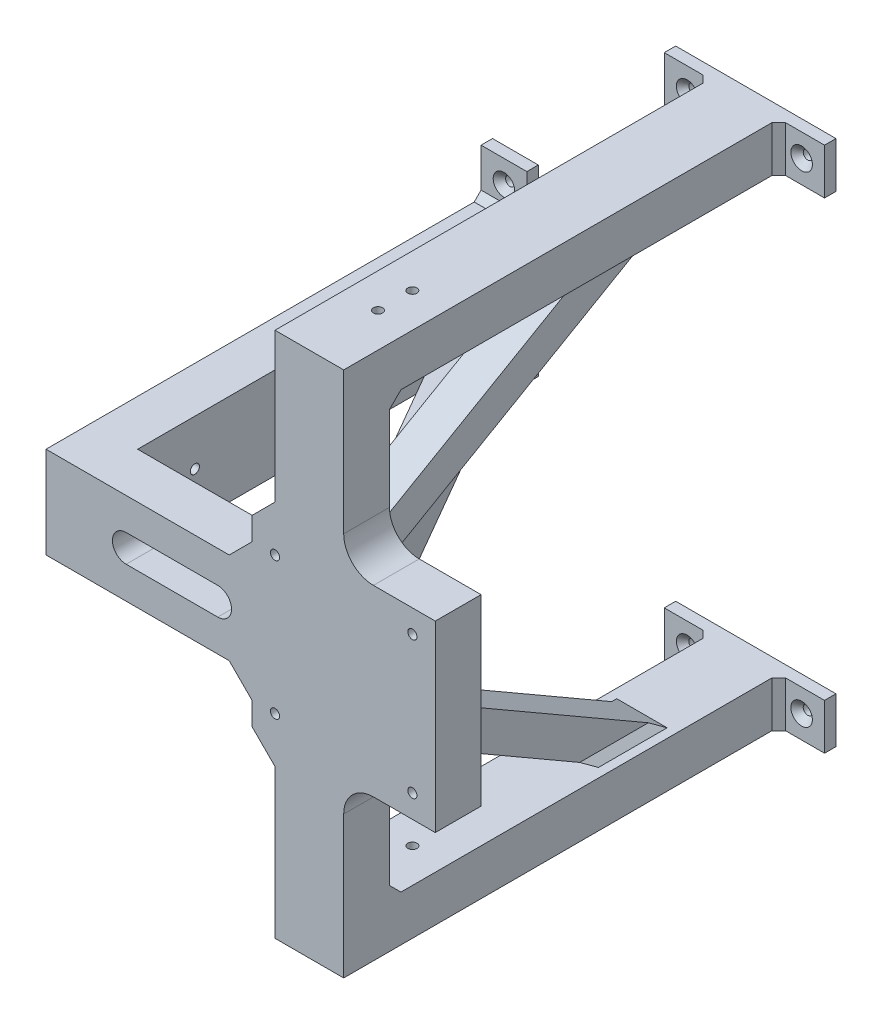
from build123d import *

# Parameters (mm, degrees)
BOSS_EXTRUDE1_DEPTH                                 = 80
BOSS_EXTRUDE1_DEPTH_BACK                            = 115
SKETCH2_W                                           = 230
SKETCH2_H                                           = 130
CUT_EXTRUDE1_REACH                                  = 237.531
SKETCH3_W                                           = 100
SKETCH3_H                                           = 95
SKETCH4_W                                           = 190
SKETCH4_H                                           = 175
CUT_EXTRUDE2_DEPTH                                  = 110
BOSS_EXTRUDE3_DEPTH                                 = 40
BOSS_EXTRUDE3_DEPTH_BACK                            = 40
SKETCH11_W                                          = 80
SKETCH11_H                                          = 20
SKETCH12_W                                          = 70
SKETCH12_H                                          = 20
BOSS_EXTRUDE4_DEPTH                                 = 5
CSK_FOR_M4_COUNTERSUNK_FLAT_HEAD_SCREW1_D           = 4
CSK_FOR_M4_COUNTERSUNK_FLAT_HEAD_SCREW1_CSINK_D     = 9.4
CSK_FOR_M4_COUNTERSUNK_FLAT_HEAD_SCREW1_CSINK_ANGLE = 90
SKETCH15_W                                          = 20
SKETCH15_H                                          = 80
BOSS_EXTRUDE5_DEPTH                                 = 5
CSK_FOR_M4_COUNTERSUNK_FLAT_HEAD_SCREW2_D           = 4
CSK_FOR_M4_COUNTERSUNK_FLAT_HEAD_SCREW2_CSINK_D     = 9.4
CSK_FOR_M4_COUNTERSUNK_FLAT_HEAD_SCREW2_CSINK_ANGLE = 90
F_4_0_4_DIAMETER_HOLE2_D                            = 4
F_4_0_4_DIAMETER_HOLE1_D                            = 4
F_4_0_4_DIAMETER_HOLE3_D                            = 4
CUT_EXTRUDE3_DEPTH                                  = 3
BOSS_EXTRUDE6_DEPTH                                 = 8
BOSS_EXTRUDE7_DEPTH                                 = 12
BOSS_EXTRUDE7_DEPTH_BACK                            = 12
CUT_EXTRUDE4_REACH                                  = 251.55
CHAMFER1_SIZE                                       = 5
CHAMFER2_SIZE                                       = 3
CHAMFER3_SIZE                                       = 3
FILLET1_R                                           = 3
CHAMFER4_SIZE                                       = 3
FILLET2_R                                           = 13
CHAMFER6_SIZE                                       = 10


# Some blends are built 0.0001 mm under size
with BuildPart() as part:
    # Sketch2 → Boss-Extrude1 (new, two sides: drawn at the far end of the back side and taken through both)
    with BuildSketch(Plane(origin=(0, 0, 0), x_dir=(0, 1, 0), z_dir=(0, 0, 1)).offset(-BOSS_EXTRUDE1_DEPTH_BACK)):
        Rectangle(SKETCH2_W, SKETCH2_H)
    extrude(amount=BOSS_EXTRUDE1_DEPTH + BOSS_EXTRUDE1_DEPTH_BACK)

    # Sketch3 → Cut-Extrude1 (cut, up to next)
    with BuildSketch(Plane.XY.offset(80), mode=Mode.PRIVATE) as cut_extrude1_sk1:
        with Locations((-15, 67.5)):
            Rectangle(SKETCH3_W, SKETCH3_H)
    cut_extrude1_tool1 = extrude(cut_extrude1_sk1.sketch, amount=-CUT_EXTRUDE1_REACH, mode=Mode.PRIVATE) & part.part
    cut_extrude1 = cut_extrude1_tool1.solids().sort_by_distance((-15, 67.5, 80))[0]
    add(cut_extrude1, mode=Mode.SUBTRACT)

    # Mirror1: Cut-Extrude1 across plane
    add(cut_extrude1.mirror(Plane.ZX), mode=Mode.SUBTRACT)

    # Sketch4 → Cut-Extrude2 (cut)
    with BuildSketch(Plane.YZ.offset(65)):
        with Locations((0, -27.5)):
            Rectangle(SKETCH4_W, SKETCH4_H)
    extrude(amount=-CUT_EXTRUDE2_DEPTH, mode=Mode.SUBTRACT)

    # Sketch11 → Boss-Extrude3 (add, two sides: drawn at the far end of the back side and taken through both)
    with BuildSketch(Plane.YZ.offset(65).offset(-BOSS_EXTRUDE3_DEPTH_BACK)):
        with Locations((0, 70)):
            Rectangle(SKETCH11_W, SKETCH11_H)
    extrude(amount=BOSS_EXTRUDE3_DEPTH + BOSS_EXTRUDE3_DEPTH_BACK)

    # Sketch12 → Boss-Extrude4 (add)
    with BuildSketch(Plane(origin=(0, 0, -115), x_dir=(1, 0, 0), z_dir=(0, 0, -1))):
        with Locations((50, -105)):
            Rectangle(SKETCH12_W, SKETCH12_H)
    boss_extrude4 = extrude(amount=-BOSS_EXTRUDE4_DEPTH)

    # CSK for M4 Countersunk Flat Head Screw1 (through all)
    with Locations(Plane(origin=(0, 0, -110), x_dir=(-1, 0, 0), z_dir=(0, 0, 1))):
        with Locations((-75, -105), (-25, -105)):
            csk_for_m4_countersunk_flat_head_screw1 = CounterSinkHole(CSK_FOR_M4_COUNTERSUNK_FLAT_HEAD_SCREW1_D / 2, CSK_FOR_M4_COUNTERSUNK_FLAT_HEAD_SCREW1_CSINK_D / 2, counter_sink_angle=CSK_FOR_M4_COUNTERSUNK_FLAT_HEAD_SCREW1_CSINK_ANGLE)

    # Mirror2: Boss-Extrude4, CSK for M4 Countersunk Flat Head Screw1 across plane
    add(boss_extrude4.mirror(Plane.ZX))
    add(csk_for_m4_countersunk_flat_head_screw1.mirror(Plane.ZX), mode=Mode.SUBTRACT)

    # Sketch15 → Boss-Extrude5 (add)
    with BuildSketch(Plane(origin=(0, 0, -115), x_dir=(1, 0, 0), z_dir=(0, 0, -1))):
        with Locations((-55, 0)):
            Rectangle(SKETCH15_W, SKETCH15_H)
    extrude(amount=-BOSS_EXTRUDE5_DEPTH)

    # CSK for M4 Countersunk Flat Head Screw2 (through all)
    with Locations(Plane.XY.offset(-110)):
        with Locations((-55, -30), (-55, 30)):
            CounterSinkHole(CSK_FOR_M4_COUNTERSUNK_FLAT_HEAD_SCREW2_D / 2, CSK_FOR_M4_COUNTERSUNK_FLAT_HEAD_SCREW2_CSINK_D / 2, counter_sink_angle=CSK_FOR_M4_COUNTERSUNK_FLAT_HEAD_SCREW2_CSINK_ANGLE)

    # Ø4.0 (4) Diameter Hole2 (through all)
    with Locations(Plane.XY.offset(80)):
        with Locations((35, 30), (95, 30), (95, -30), (35, -30)):
            Hole(F_4_0_4_DIAMETER_HOLE2_D / 2)

    # Ø4.0 (4) Diameter Hole1 (through all)
    with Locations(Plane(origin=(-65, 0, 0), x_dir=(0, -1, 0), z_dir=(-1, 0, 0))):
        with Locations((0, 50), (0, 35)):
            Hole(F_4_0_4_DIAMETER_HOLE1_D / 2)

    # Ø4.0 (4) Diameter Hole3 (through all)
    with Locations(Plane(origin=(0, -115, 0), x_dir=(-1, 0, 0), z_dir=(0, -1, 0))):
        with Locations((-50, -35), (-50, -50)):
            Hole(F_4_0_4_DIAMETER_HOLE3_D / 2)

    # Sketch33 → Cut-Extrude3 (cut)
    with BuildSketch(Plane(origin=(0, 0, 60), x_dir=(1, 0, 0), z_dir=(0, 0, -1))):
        Polygon((39.156921938, 30), (37.078460969, 33.6), (32.921539031, 33.6), (30.843078062, 30), (32.921539031, 26.4), (37.078460969, 26.4), align=None)
        Polygon((97.078460969, 33.6), (92.921539031, 33.6), (90.843078062, 30), (92.921539031, 26.4), (97.078460969, 26.4), (99.156921938, 30), align=None)
        Polygon((99.156921938, -30), (97.078460969, -33.6), (92.921539031, -33.6), (90.843078062, -30), (92.921539031, -26.4), (97.078460969, -26.4), align=None)
        Polygon((37.078460969, -26.4), (39.156921938, -30), (37.078460969, -33.6), (32.921539031, -33.6), (30.843078062, -30), (32.921539031, -26.4), align=None)
    extrude(amount=-CUT_EXTRUDE3_DEPTH, mode=Mode.SUBTRACT)

    # Sketch34 → Boss-Extrude6 (add, symmetric)
    with BuildSketch(Plane(origin=(50, 0, 0), x_dir=(0, 0, -1), z_dir=(1, 0, 0))):
        Polygon((-60, -22.679491924), (65.262794416, -95), (35.262794416, -95), (-60, -40), align=None)
    boss_extrude6 = extrude(amount=BOSS_EXTRUDE6_DEPTH, both=True)

    # Mirror3: Boss-Extrude6 across plane
    add(boss_extrude6.mirror(Plane.ZX))

    # Sketch35 → Boss-Extrude7 (add, two sides: drawn at the far end of the back side and taken through both)
    with BuildSketch(Plane(origin=(0, 0, 0), x_dir=(-1, 0, 0), z_dir=(0, 1, 0)).offset(-BOSS_EXTRUDE7_DEPTH_BACK)):
        Polygon((-38.715789032, 60), (45, -85), (45, -115), (-56.036297108, 60), align=None)
    extrude(amount=BOSS_EXTRUDE7_DEPTH + BOSS_EXTRUDE7_DEPTH_BACK)

    # Sketch36 → Cut-Extrude4 (cut, up to next)
    with BuildSketch(Plane.XY.offset(80), mode=Mode.PRIVATE) as cut_extrude4_sk1:
        with BuildLine():
            Line((-30, 6), (10, 6))
            ThreePointArc((10, 6), (16, 0), (10, -6))
            Line((10, -6), (-30, -6))
            ThreePointArc((-30, -6), (-36, 0), (-30, 6))
        make_face()
    cut_extrude4_tool1 = extrude(cut_extrude4_sk1.sketch, amount=-CUT_EXTRUDE4_REACH, mode=Mode.PRIVATE) & part.part
    add(cut_extrude4_tool1.solids().sort_by_distance((-10, 0, 80))[0], mode=Mode.SUBTRACT)

    # Chamfer1
    chamfer1_edges = [part.edges().sort_by_distance(p)[0] for p in [
        (50, -95, 60),
        (50, 95, 60),
    ]]
    chamfer(chamfer1_edges, length=CHAMFER1_SIZE)

    # Chamfer2
    chamfer2_edges = [part.edges().sort_by_distance(p)[0] for p in [
        (42, -95, -50.262794416),
        (58, -95, -50.262794416),
        (58, 95, -50.262794416),
        (42, 95, -50.262794416),
    ]]
    chamfer(chamfer2_edges, length=CHAMFER2_SIZE)

    # Chamfer3
    # the kernel refuses this chamfer: 3 mm, written as the material it adds along each edge
    with BuildSketch(Plane(origin=(-45, -12, -77.284951036), x_dir=(0.9996219169112968, 0.02749587661058619, 0), z_dir=(0, 0, -1))) as chamfer3_piece_1_section:
        Polygon((CHAMFER3_SIZE * 0.999621916911, CHAMFER3_SIZE * 0.0274958766106), (-CHAMFER3_SIZE * 0.0274958766106, CHAMFER3_SIZE * 0.999621916911), (0, 0), align=None)
    chamfer3_piece_1 = extrude(amount=37.715048964, mode=Mode.PRIVATE)
    chamfer3_piece_1 = split(chamfer3_piece_1, bisect_by=Plane(origin=(-50.504968859, -12.989254534, -94.534885758), z_dir=(0.866025403784438, 0, -0.5000000000000012)), keep=Keep.TOP, mode=Mode.PRIVATE)
    chamfer3_piece_1 = split(chamfer3_piece_1, bisect_by=Plane(origin=(-37.514587803, -12.989254534, -102.034885758), z_dir=(-0.8660254037844379, 0, 0.5000000000000012)), keep=Keep.TOP, mode=Mode.PRIVATE)
    add(chamfer3_piece_1)
    with BuildSketch(Plane(origin=(-45, 12, -77.284951036), x_dir=(0.9996219169112968, -0.02749587661058619, 0), z_dir=(0, 0, -1))) as chamfer3_piece_2_section:
        Polygon((CHAMFER3_SIZE * 0.999621916911, -CHAMFER3_SIZE * 0.0274958766106), (-CHAMFER3_SIZE * 0.0274958766106, -CHAMFER3_SIZE * 0.999621916911), (0, 0), align=None)
    chamfer3_piece_2 = extrude(amount=37.715048964, mode=Mode.PRIVATE)
    chamfer3_piece_2 = split(chamfer3_piece_2, bisect_by=Plane(origin=(-50.504968859, 12.989254534, -94.534885758), z_dir=(0.866025403784438, 0, -0.5000000000000012)), keep=Keep.TOP, mode=Mode.PRIVATE)
    chamfer3_piece_2 = split(chamfer3_piece_2, bisect_by=Plane(origin=(-37.514587803, 12.989254534, -102.034885758), z_dir=(-0.8660254037844379, 0, 0.5000000000000012)), keep=Keep.TOP, mode=Mode.PRIVATE)
    add(chamfer3_piece_2)

    # Fillet1
    # the kernel refuses this fillet: 3 mm, written as the material it adds along each edge
    with BuildSketch(Plane(origin=(42, -47.5, 60), x_dir=(-1, 0, 0), z_dir=(0, 1, 0))) as fillet1_piece_1_section:
        with BuildLine():
            CenterArc((FILLET1_R, -FILLET1_R), FILLET1_R, 90, 90)
            Line((0, -FILLET1_R), (0, 0))
            Line((0, 0), (FILLET1_R, 0))
        make_face()
    fillet1_piece_1 = extrude(amount=32.320508076, mode=Mode.PRIVATE)
    fillet1_piece_1 = split(fillet1_piece_1, bisect_by=Plane(origin=(42.701682436, -36.139705283, 59.348770082), z_dir=(-0.8660254037844397, -0.49999999999999817, 0)), keep=Keep.TOP, mode=Mode.PRIVATE)
    fillet1_piece_1 = split(fillet1_piece_1, bisect_by=Plane(origin=(36.650507803, -34.341236628, 59.348770082), z_dir=(0.8660254037844397, -0.4999999999999984, 0)), keep=Keep.TOP, mode=Mode.PRIVATE)
    fillet1_piece_1 = split(fillet1_piece_1, bisect_by=Plane(origin=(41.233614663, -39.528814478, 60.816117264), z_dir=(0, 0.8660254037844417, -0.4999999999999946)), keep=Keep.TOP, mode=Mode.PRIVATE)
    add(fillet1_piece_1)
    with BuildSketch(Plane(origin=(42, -47.5, 60), x_dir=(-1, 0, 0), z_dir=(0, 1, 0))) as fillet1_piece_2_section:
        with BuildLine():
            CenterArc((FILLET1_R, -FILLET1_R), FILLET1_R, 90, 90)
            Line((0, -FILLET1_R), (0, 0))
            Line((0, 0), (FILLET1_R, 0))
        make_face()
    fillet1_piece_2 = extrude(amount=32.320508076, mode=Mode.PRIVATE)
    fillet1_piece_2 = split(fillet1_piece_2, bisect_by=Plane(origin=(39.746128625, -31.020535918, 59.206741309), z_dir=(0.8660254037844397, 0.49999999999999817, 0)), keep=Keep.TOP, mode=Mode.PRIVATE)
    fillet1_piece_2 = split(fillet1_piece_2, bisect_by=Plane(origin=(39.746128625, -28.979464082, 59.206741309), z_dir=(0.8660254037844397, -0.4999999999999984, 0)), keep=Keep.TOP, mode=Mode.PRIVATE)
    add(fillet1_piece_2)
    with BuildSketch(Plane(origin=(42, -47.5, 60), x_dir=(-1, 0, 0), z_dir=(0, 1, 0))) as fillet1_piece_3_section:
        with BuildLine():
            CenterArc((FILLET1_R, -FILLET1_R), FILLET1_R, 90, 90)
            Line((0, -FILLET1_R), (0, 0))
            Line((0, 0), (FILLET1_R, 0))
        make_face()
    fillet1_piece_3 = extrude(amount=32.320508076, mode=Mode.PRIVATE)
    fillet1_piece_3 = split(fillet1_piece_3, bisect_by=Plane(origin=(37.393549663, -26.945749626, 59.531147804), z_dir=(0.8660254037844397, 0.49999999999999817, 0)), keep=Keep.TOP, mode=Mode.PRIVATE)
    fillet1_piece_3 = split(fillet1_piece_3, bisect_by=Plane(origin=(41.866264753, -25.30728059, 59.531147804), z_dir=(-0.8660254037844397, 0.4999999999999984, 0)), keep=Keep.TOP, mode=Mode.PRIVATE)
    fillet1_piece_3 = split(fillet1_piece_3, bisect_by=Plane(origin=(41.048863017, -23.421476269, 58.714845417), z_dir=(0, -0.8660254037844418, 0.4999999999999946)), keep=Keep.TOP, mode=Mode.PRIVATE)
    add(fillet1_piece_3)
    with BuildSketch(Plane(origin=(42, -22.679491924, 60), x_dir=(0, 1, 0), z_dir=(1, 0, 0))) as fillet1_piece_4:
        with BuildLine():
            CenterArc((FILLET1_R * 0.57735026919, -FILLET1_R), FILLET1_R, 90, 60)
            Line((-FILLET1_R * 0.288675134595, -FILLET1_R * 0.5), (0, 0))
            Line((0, 0), (FILLET1_R * 0.57735026919, 0))
        make_face()
    extrude(amount=16)
    with BuildSketch(Plane(origin=(58, -47.5, 60), x_dir=(1, 0, 0), z_dir=(0, 1, 0))) as fillet1_piece_5_section:
        with BuildLine():
            CenterArc((FILLET1_R, FILLET1_R), FILLET1_R, 180, 90)
            Line((0, FILLET1_R), (0, 0))
            Line((0, 0), (FILLET1_R, 0))
        make_face()
    fillet1_piece_5 = extrude(amount=32.320508076, mode=Mode.PRIVATE)
    fillet1_piece_5 = split(fillet1_piece_5, bisect_by=Plane(origin=(58.679185343, -38.227064331, 63.070814657), z_dir=(0, 0.8660254037844417, -0.4999999999999946)), keep=Keep.TOP, mode=Mode.PRIVATE)
    fillet1_piece_5 = split(fillet1_piece_5, bisect_by=Plane(origin=(58.679185343, -25.236683274, 55.570814657), z_dir=(0, -0.8660254037844418, 0.4999999999999946)), keep=Keep.TOP, mode=Mode.PRIVATE)
    add(fillet1_piece_5)
    with BuildSketch(Plane(origin=(42, 22.679491924, 60), x_dir=(0, -1, 0), z_dir=(1, 0, 0))) as fillet1_piece_6:
        with BuildLine():
            CenterArc((FILLET1_R * 0.57735026919, FILLET1_R), FILLET1_R, 210, 60)
            Line((-FILLET1_R * 0.288675134595, FILLET1_R * 0.5), (0, 0))
            Line((0, 0), (FILLET1_R * 0.57735026919, 0))
        make_face()
    extrude(amount=16)
    with BuildSketch(Plane(origin=(58, 47.5, 60), x_dir=(1, 0, 0), z_dir=(0, -1, 0))) as fillet1_piece_7_section:
        with BuildLine():
            CenterArc((FILLET1_R, -FILLET1_R), FILLET1_R, 90, 90)
            Line((0, -FILLET1_R), (0, 0))
            Line((0, 0), (FILLET1_R, 0))
        make_face()
    fillet1_piece_7 = extrude(amount=32.320508076, mode=Mode.PRIVATE)
    fillet1_piece_7 = split(fillet1_piece_7, bisect_by=Plane(origin=(58.679185343, 38.227064331, 63.070814657), z_dir=(0, -0.8660254037844417, -0.4999999999999946)), keep=Keep.TOP, mode=Mode.PRIVATE)
    fillet1_piece_7 = split(fillet1_piece_7, bisect_by=Plane(origin=(58.679185343, 25.236683274, 55.570814657), z_dir=(0, 0.8660254037844418, 0.4999999999999946)), keep=Keep.TOP, mode=Mode.PRIVATE)
    add(fillet1_piece_7)
    with BuildSketch(Plane(origin=(42, 47.5, 60), x_dir=(-1, 0, 0), z_dir=(0, -1, 0))) as fillet1_piece_8_section:
        with BuildLine():
            CenterArc((FILLET1_R, FILLET1_R), FILLET1_R, 180, 90)
            Line((0, FILLET1_R), (0, 0))
            Line((0, 0), (FILLET1_R, 0))
        make_face()
    fillet1_piece_8 = extrude(amount=32.320508076, mode=Mode.PRIVATE)
    fillet1_piece_8 = split(fillet1_piece_8, bisect_by=Plane(origin=(42.701682436, 36.139705283, 59.348770082), z_dir=(-0.8660254037844397, 0.49999999999999817, 0)), keep=Keep.TOP, mode=Mode.PRIVATE)
    fillet1_piece_8 = split(fillet1_piece_8, bisect_by=Plane(origin=(36.650507803, 34.341236628, 59.348770082), z_dir=(0.8660254037844397, 0.4999999999999984, 0)), keep=Keep.TOP, mode=Mode.PRIVATE)
    fillet1_piece_8 = split(fillet1_piece_8, bisect_by=Plane(origin=(41.233614663, 39.528814478, 60.816117264), z_dir=(0, -0.8660254037844417, -0.4999999999999946)), keep=Keep.TOP, mode=Mode.PRIVATE)
    add(fillet1_piece_8)
    with BuildSketch(Plane(origin=(42, 47.5, 60), x_dir=(-1, 0, 0), z_dir=(0, -1, 0))) as fillet1_piece_9_section:
        with BuildLine():
            CenterArc((FILLET1_R, FILLET1_R), FILLET1_R, 180, 90)
            Line((0, FILLET1_R), (0, 0))
            Line((0, 0), (FILLET1_R, 0))
        make_face()
    fillet1_piece_9 = extrude(amount=32.320508076, mode=Mode.PRIVATE)
    fillet1_piece_9 = split(fillet1_piece_9, bisect_by=Plane(origin=(39.746128625, 31.020535918, 59.206741309), z_dir=(0.8660254037844397, -0.49999999999999817, 0)), keep=Keep.TOP, mode=Mode.PRIVATE)
    fillet1_piece_9 = split(fillet1_piece_9, bisect_by=Plane(origin=(39.746128625, 28.979464082, 59.206741309), z_dir=(0.8660254037844397, 0.4999999999999984, 0)), keep=Keep.TOP, mode=Mode.PRIVATE)
    add(fillet1_piece_9)
    with BuildSketch(Plane(origin=(42, 47.5, 60), x_dir=(-1, 0, 0), z_dir=(0, -1, 0))) as fillet1_piece_10_section:
        with BuildLine():
            CenterArc((FILLET1_R, FILLET1_R), FILLET1_R, 180, 90)
            Line((0, FILLET1_R), (0, 0))
            Line((0, 0), (FILLET1_R, 0))
        make_face()
    fillet1_piece_10 = extrude(amount=32.320508076, mode=Mode.PRIVATE)
    fillet1_piece_10 = split(fillet1_piece_10, bisect_by=Plane(origin=(37.393549663, 26.945749626, 59.531147804), z_dir=(0.8660254037844397, -0.49999999999999817, 0)), keep=Keep.TOP, mode=Mode.PRIVATE)
    fillet1_piece_10 = split(fillet1_piece_10, bisect_by=Plane(origin=(41.866264753, 25.30728059, 59.531147804), z_dir=(-0.8660254037844397, -0.4999999999999984, 0)), keep=Keep.TOP, mode=Mode.PRIVATE)
    fillet1_piece_10 = split(fillet1_piece_10, bisect_by=Plane(origin=(41.048863017, 23.421476269, 58.714845417), z_dir=(0, 0.8660254037844418, 0.4999999999999946)), keep=Keep.TOP, mode=Mode.PRIVATE)
    add(fillet1_piece_10)
    with BuildSketch(Plane(origin=(56.036297108, -12, 60), x_dir=(1, 0, 0), z_dir=(0, 1, 0))) as fillet1_piece_11:
        with BuildLine():
            CenterArc((FILLET1_R * 0.577350269205, FILLET1_R), FILLET1_R, 210, 60)
            Line((-FILLET1_R * 0.288675134579, FILLET1_R * 0.5), (0, 0))
            Line((0, 0), (FILLET1_R * 0.577350269205, 0))
        make_face()
    extrude(amount=24)
    with BuildSketch(Plane(origin=(63.536297108, -12, 60), x_dir=(0, -1, 0), z_dir=(-1, 0, 0))) as fillet1_piece_12_section:
        with BuildLine():
            CenterArc((FILLET1_R, -FILLET1_R), FILLET1_R, 90, 90)
            Line((0, -FILLET1_R), (0, 0))
            Line((0, 0), (FILLET1_R, 0))
        make_face()
    fillet1_piece_12 = extrude(amount=32.320508076, mode=Mode.PRIVATE)
    fillet1_piece_12 = split(fillet1_piece_12, bisect_by=Plane(origin=(53.479105758, -12.679185343, 55.570814657), z_dir=(-0.866025403784329, 0, 0.50000000000019)), keep=Keep.TOP, mode=Mode.PRIVATE)
    fillet1_piece_12 = split(fillet1_piece_12, bisect_by=Plane(origin=(40.488724702, -12.679185343, 63.070814657), z_dir=(0.866025403784329, 0, -0.50000000000019)), keep=Keep.TOP, mode=Mode.PRIVATE)
    add(fillet1_piece_12)
    with BuildSketch(Plane(origin=(38.715789032, -12, 60), x_dir=(-1, 0, 0), z_dir=(0, 1, 0))) as fillet1_piece_13:
        with BuildLine():
            CenterArc((FILLET1_R * 1.73205080755, -FILLET1_R), FILLET1_R, 90, 120)
            Line((FILLET1_R * 0.86602540377, -FILLET1_R * 1.5), (0, 0))
            Line((0, 0), (FILLET1_R * 1.73205080755, 0))
        make_face()
    extrude(amount=24)
    with BuildSketch(Plane(origin=(63.536297108, 12, 60), x_dir=(0, 0, -1), z_dir=(-1, 0, 0))) as fillet1_piece_14_section:
        with BuildLine():
            CenterArc((FILLET1_R, -FILLET1_R), FILLET1_R, 90, 90)
            Line((0, -FILLET1_R), (0, 0))
            Line((0, 0), (FILLET1_R, 0))
        make_face()
    fillet1_piece_14 = extrude(amount=32.320508076, mode=Mode.PRIVATE)
    fillet1_piece_14 = split(fillet1_piece_14, bisect_by=Plane(origin=(53.479105758, 12.679185343, 55.570814657), z_dir=(-0.866025403784329, 0, 0.50000000000019)), keep=Keep.TOP, mode=Mode.PRIVATE)
    fillet1_piece_14 = split(fillet1_piece_14, bisect_by=Plane(origin=(40.488724702, 12.679185343, 63.070814657), z_dir=(0.866025403784329, 0, -0.50000000000019)), keep=Keep.TOP, mode=Mode.PRIVATE)
    add(fillet1_piece_14)
    with BuildSketch(Plane(origin=(42, -47.5, 60), x_dir=(-1, 0, 0), z_dir=(0, 1, 0))) as fillet1_piece_15a_section:
        with BuildLine():
            CenterArc((FILLET1_R, -FILLET1_R), FILLET1_R, 90, 90)
            Line((0, -FILLET1_R), (0, 0))
            Line((0, 0), (FILLET1_R, 0))
        make_face()
    fillet1_piece_15a = extrude(amount=32.320508076, mode=Mode.PRIVATE)
    fillet1_piece_15a = split(fillet1_piece_15a, bisect_by=Plane(origin=(41.33889207, -22.100562375, 61.002735393), z_dir=(0, 0.8660254037844418, -0.4999999999999946)), keep=Keep.TOP, mode=Mode.PRIVATE)
    with BuildSketch(Plane(origin=(37.669872981, -22.679491924, 60), x_dir=(0, 1, 0), z_dir=(1, 0, 0))) as fillet1_piece_15b_section:
        with BuildLine():
            CenterArc((FILLET1_R * 0.57735026919, -FILLET1_R), FILLET1_R, 90, 60)
            Line((-FILLET1_R * 0.288675134595, -FILLET1_R * 0.5), (0, 0))
            Line((0, 0), (FILLET1_R * 0.57735026919, 0))
        make_face()
    fillet1_piece_15b = extrude(amount=20.330127019, mode=Mode.PRIVATE)
    fillet1_piece_15b = split(fillet1_piece_15b, bisect_by=Plane(origin=(42, -22.491855896, 59.675004866), z_dir=(-1, 0, 0)), keep=Keep.TOP, mode=Mode.PRIVATE)
    fillet1_piece_15 = fillet1_piece_15a & fillet1_piece_15b
    add(fillet1_piece_15)
    with BuildSketch(Plane(origin=(42, -22.679491924, 60), x_dir=(0, 1, 0), z_dir=(1, 0, 0))) as fillet1_piece_16a_section:
        with BuildLine():
            CenterArc((FILLET1_R * 0.57735026919, -FILLET1_R), FILLET1_R, 90, 60)
            Line((-FILLET1_R * 0.288675134595, -FILLET1_R * 0.5), (0, 0))
            Line((0, 0), (FILLET1_R * 0.57735026919, 0))
        make_face()
    fillet1_piece_16a = extrude(amount=20.330127019, mode=Mode.PRIVATE)
    fillet1_piece_16a = split(fillet1_piece_16a, bisect_by=Plane(origin=(58, -22.491855896, 59.675004866), z_dir=(1, 0, 0)), keep=Keep.TOP, mode=Mode.PRIVATE)
    with BuildSketch(Plane(origin=(58, -47.5, 60), x_dir=(1, 0, 0), z_dir=(0, 1, 0))) as fillet1_piece_16b_section:
        with BuildLine():
            CenterArc((FILLET1_R, FILLET1_R), FILLET1_R, 180, 90)
            Line((0, FILLET1_R), (0, 0))
            Line((0, 0), (FILLET1_R, 0))
        make_face()
    fillet1_piece_16b = extrude(amount=32.320508076, mode=Mode.PRIVATE)
    fillet1_piece_16b = split(fillet1_piece_16b, bisect_by=Plane(origin=(58.66110793, -22.100562375, 61.002735393), z_dir=(0, 0.8660254037844418, -0.4999999999999946)), keep=Keep.TOP, mode=Mode.PRIVATE)
    fillet1_piece_16 = fillet1_piece_16a & fillet1_piece_16b
    add(fillet1_piece_16)
    with BuildSketch(Plane(origin=(37.669872981, 22.679491924, 60), x_dir=(0, -1, 0), z_dir=(1, 0, 0))) as fillet1_piece_17a_section:
        with BuildLine():
            CenterArc((FILLET1_R * 0.57735026919, FILLET1_R), FILLET1_R, 210, 60)
            Line((-FILLET1_R * 0.288675134595, FILLET1_R * 0.5), (0, 0))
            Line((0, 0), (FILLET1_R * 0.57735026919, 0))
        make_face()
    fillet1_piece_17a = extrude(amount=20.330127019, mode=Mode.PRIVATE)
    fillet1_piece_17a = split(fillet1_piece_17a, bisect_by=Plane(origin=(42, 22.491855896, 59.675004866), z_dir=(-1, 0, 0)), keep=Keep.TOP, mode=Mode.PRIVATE)
    with BuildSketch(Plane(origin=(42, 47.5, 60), x_dir=(-1, 0, 0), z_dir=(0, -1, 0))) as fillet1_piece_17b_section:
        with BuildLine():
            CenterArc((FILLET1_R, FILLET1_R), FILLET1_R, 180, 90)
            Line((0, FILLET1_R), (0, 0))
            Line((0, 0), (FILLET1_R, 0))
        make_face()
    fillet1_piece_17b = extrude(amount=32.320508076, mode=Mode.PRIVATE)
    fillet1_piece_17b = split(fillet1_piece_17b, bisect_by=Plane(origin=(41.33889207, 22.100562375, 61.002735393), z_dir=(0, -0.8660254037844418, -0.4999999999999946)), keep=Keep.TOP, mode=Mode.PRIVATE)
    fillet1_piece_17 = fillet1_piece_17a & fillet1_piece_17b
    add(fillet1_piece_17)
    with BuildSketch(Plane(origin=(42, 22.679491924, 60), x_dir=(0, -1, 0), z_dir=(1, 0, 0))) as fillet1_piece_18a_section:
        with BuildLine():
            CenterArc((FILLET1_R * 0.57735026919, FILLET1_R), FILLET1_R, 210, 60)
            Line((-FILLET1_R * 0.288675134595, FILLET1_R * 0.5), (0, 0))
            Line((0, 0), (FILLET1_R * 0.57735026919, 0))
        make_face()
    fillet1_piece_18a = extrude(amount=20.330127019, mode=Mode.PRIVATE)
    fillet1_piece_18a = split(fillet1_piece_18a, bisect_by=Plane(origin=(58, 22.491855896, 59.675004866), z_dir=(1, 0, 0)), keep=Keep.TOP, mode=Mode.PRIVATE)
    with BuildSketch(Plane(origin=(58, 47.5, 60), x_dir=(1, 0, 0), z_dir=(0, -1, 0))) as fillet1_piece_18b_section:
        with BuildLine():
            CenterArc((FILLET1_R, -FILLET1_R), FILLET1_R, 90, 90)
            Line((0, -FILLET1_R), (0, 0))
            Line((0, 0), (FILLET1_R, 0))
        make_face()
    fillet1_piece_18b = extrude(amount=32.320508076, mode=Mode.PRIVATE)
    fillet1_piece_18b = split(fillet1_piece_18b, bisect_by=Plane(origin=(58.66110793, 22.100562375, 61.002735393), z_dir=(0, -0.8660254037844418, -0.4999999999999946)), keep=Keep.TOP, mode=Mode.PRIVATE)
    fillet1_piece_18 = fillet1_piece_18a & fillet1_piece_18b
    add(fillet1_piece_18)
    with BuildSketch(Plane(origin=(63.536297108, -12, 60), x_dir=(0, -1, 0), z_dir=(-1, 0, 0))) as fillet1_piece_19a_section:
        with BuildLine():
            CenterArc((FILLET1_R, -FILLET1_R), FILLET1_R, 90, 90)
            Line((0, -FILLET1_R), (0, 0))
            Line((0, 0), (FILLET1_R, 0))
        make_face()
    fillet1_piece_19a = extrude(amount=32.320508076, mode=Mode.PRIVATE)
    fillet1_piece_19a = split(fillet1_piece_19a, bisect_by=Plane(origin=(56.615226658, -12.66110793, 61.002735393), z_dir=(0.866025403784329, 0, -0.50000000000019)), keep=Keep.TOP, mode=Mode.PRIVATE)
    with BuildSketch(Plane(origin=(56.036297108, -16.330127019, 60), x_dir=(1, 0, 0), z_dir=(0, 1, 0))) as fillet1_piece_19b_section:
        with BuildLine():
            CenterArc((FILLET1_R * 0.577350269189, FILLET1_R), FILLET1_R, 210, 60)
            Line((-FILLET1_R * 0.288675134595, FILLET1_R * 0.5), (0, 0))
            Line((0, 0), (FILLET1_R * 0.577350269189, 0))
        make_face()
    fillet1_piece_19b = extrude(amount=28.330127019, mode=Mode.PRIVATE)
    fillet1_piece_19b = split(fillet1_piece_19b, bisect_by=Plane(origin=(56.223933136, -12, 59.675004866), z_dir=(0, -1, 0)), keep=Keep.TOP, mode=Mode.PRIVATE)
    fillet1_piece_19 = fillet1_piece_19a & fillet1_piece_19b
    add(fillet1_piece_19)
    with BuildSketch(Plane(origin=(63.536297108, 12, 60), x_dir=(0, 0, -1), z_dir=(-1, 0, 0))) as fillet1_piece_20a_section:
        with BuildLine():
            CenterArc((FILLET1_R, -FILLET1_R), FILLET1_R, 90, 90)
            Line((0, -FILLET1_R), (0, 0))
            Line((0, 0), (FILLET1_R, 0))
        make_face()
    fillet1_piece_20a = extrude(amount=32.320508076, mode=Mode.PRIVATE)
    fillet1_piece_20a = split(fillet1_piece_20a, bisect_by=Plane(origin=(56.615226658, 12.66110793, 61.002735393), z_dir=(0.866025403784329, 0, -0.50000000000019)), keep=Keep.TOP, mode=Mode.PRIVATE)
    with BuildSketch(Plane(origin=(56.036297108, -12, 60), x_dir=(1, 0, 0), z_dir=(0, 1, 0))) as fillet1_piece_20b_section:
        with BuildLine():
            CenterArc((FILLET1_R * 0.577350269205, FILLET1_R), FILLET1_R, 210, 60)
            Line((-FILLET1_R * 0.288675134579, FILLET1_R * 0.5), (0, 0))
            Line((0, 0), (FILLET1_R * 0.577350269205, 0))
        make_face()
    fillet1_piece_20b = extrude(amount=28.330127019, mode=Mode.PRIVATE)
    fillet1_piece_20b = split(fillet1_piece_20b, bisect_by=Plane(origin=(56.223933136, 12, 59.675004866), z_dir=(0, 1, 0)), keep=Keep.TOP, mode=Mode.PRIVATE)
    fillet1_piece_20 = fillet1_piece_20a & fillet1_piece_20b
    add(fillet1_piece_20)
    with BuildSketch(Plane(origin=(63.536297108, -12, 60), x_dir=(0, -1, 0), z_dir=(-1, 0, 0))) as fillet1_piece_21a_section:
        with BuildLine():
            CenterArc((FILLET1_R, -FILLET1_R), FILLET1_R, 90, 90)
            Line((0, -FILLET1_R), (0, 0))
            Line((0, 0), (FILLET1_R, 0))
        make_face()
    fillet1_piece_21a = extrude(amount=32.320508076, mode=Mode.PRIVATE)
    fillet1_piece_21a = split(fillet1_piece_21a, bisect_by=Plane(origin=(37.452341405, -12.699257349, 57.811644516), z_dir=(-0.866025403784329, 0, 0.50000000000019)), keep=Keep.TOP, mode=Mode.PRIVATE)
    with BuildSketch(Plane(origin=(38.715789033, -24.990381057, 60), x_dir=(-1, 0, 0), z_dir=(0, 1, 0))) as fillet1_piece_21b_section:
        with BuildLine():
            CenterArc((FILLET1_R * 1.73205080757, -FILLET1_R), FILLET1_R, 90, 120)
            Line((FILLET1_R * 0.866025403785, -FILLET1_R * 1.5), (0, 0))
            Line((0, 0), (FILLET1_R * 1.73205080757, 0))
        make_face()
    fillet1_piece_21b = extrude(amount=36.990381057, mode=Mode.PRIVATE)
    fillet1_piece_21b = split(fillet1_piece_21b, bisect_by=Plane(origin=(36.803177788, -12, 58.895753383), z_dir=(0, -1, 0)), keep=Keep.TOP, mode=Mode.PRIVATE)
    fillet1_piece_21 = fillet1_piece_21a & fillet1_piece_21b
    add(fillet1_piece_21)
    with BuildSketch(Plane(origin=(63.536297108, 12, 60), x_dir=(0, 0, -1), z_dir=(-1, 0, 0))) as fillet1_piece_22a_section:
        with BuildLine():
            CenterArc((FILLET1_R, -FILLET1_R), FILLET1_R, 90, 90)
            Line((0, -FILLET1_R), (0, 0))
            Line((0, 0), (FILLET1_R, 0))
        make_face()
    fillet1_piece_22a = extrude(amount=32.320508076, mode=Mode.PRIVATE)
    fillet1_piece_22a = split(fillet1_piece_22a, bisect_by=Plane(origin=(37.452341405, 12.699257349, 57.811644516), z_dir=(-0.866025403784329, 0, 0.50000000000019)), keep=Keep.TOP, mode=Mode.PRIVATE)
    with BuildSketch(Plane(origin=(38.715789032, -12, 60), x_dir=(-1, 0, 0), z_dir=(0, 1, 0))) as fillet1_piece_22b_section:
        with BuildLine():
            CenterArc((FILLET1_R * 1.73205080755, -FILLET1_R), FILLET1_R, 90, 120)
            Line((FILLET1_R * 0.86602540377, -FILLET1_R * 1.5), (0, 0))
            Line((0, 0), (FILLET1_R * 1.73205080755, 0))
        make_face()
    fillet1_piece_22b = extrude(amount=36.990381057, mode=Mode.PRIVATE)
    fillet1_piece_22b = split(fillet1_piece_22b, bisect_by=Plane(origin=(36.803177788, 12, 58.895753383), z_dir=(0, 1, 0)), keep=Keep.TOP, mode=Mode.PRIVATE)
    fillet1_piece_22 = fillet1_piece_22a & fillet1_piece_22b
    add(fillet1_piece_22)

    # Chamfer4
    chamfer4_edges = [part.edges().sort_by_distance(p)[0] for p in [
        (65, 105, -110),
        (35, 105, -110),
        (65, -105, -110),
        (35, -105, -110),
        (-55, 20, -110),
        (-55, -20, -110),
    ]]
    chamfer(chamfer4_edges, length=CHAMFER4_SIZE)

    # Fillet2
    fillet2_edges = [part.edges().sort_by_distance(p)[0] for p in [
        (65, 40, 70),
        (65, -40, 70),
    ]]
    fillet(fillet2_edges, radius=FILLET2_R)

    # Chamfer6
    chamfer6_edges = [part.edges().sort_by_distance(p)[0] for p in [
        (35, 40, 70),
        (35, -40, 70),
        (25, 20, 70),
        (25, -20, 70),
    ]]
    chamfer(chamfer6_edges, length=CHAMFER6_SIZE - 0.0001)  # a hair under: the kernel refuses the full size


solid = part.part
